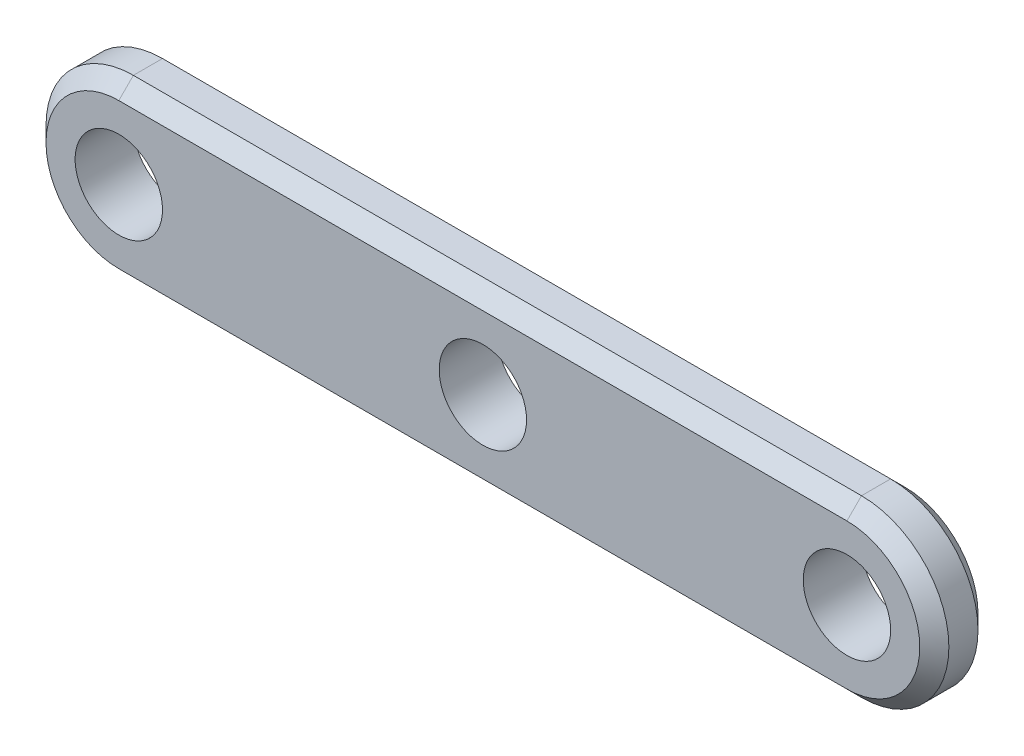
from build123d import *

# Parameters (mm, degrees)
SKETCH1_R           = 3
BOSS_EXTRUDE1_DEPTH = 4
CHAMFER1_SIZE       = 1


with BuildPart() as part:
    # Sketch1 → Boss-Extrude1 (new body)
    with BuildSketch(Plane.XY):
        with BuildLine():
            Line((50, 6), (0, 6))
            ThreePointArc((0, 6), (-6, 0), (0, -6))
            Line((0, -6), (50, -6))
            ThreePointArc((50, -6), (56, 0), (50, 6))
        make_face()
        with Locations((25, 0)):
            Circle(SKETCH1_R, mode=Mode.SUBTRACT)
        with Locations((50, 0)):
            Circle(SKETCH1_R, mode=Mode.SUBTRACT)
        Circle(SKETCH1_R, mode=Mode.SUBTRACT)
    extrude(amount=BOSS_EXTRUDE1_DEPTH)

    # Chamfer1
    chamfer1_edges = [part.edges().sort_by_distance(p)[0] for p in [
        (25, -6, 0),
        (-6, 0, 0),
        (56, 0, 0),
        (25, 6, 0),
        (25, -6, 4),
        (-6, 0, 4),
        (56, 0, 4),
        (25, 6, 4),
    ]]
    chamfer(chamfer1_edges, length=CHAMFER1_SIZE)


solid = part.part
